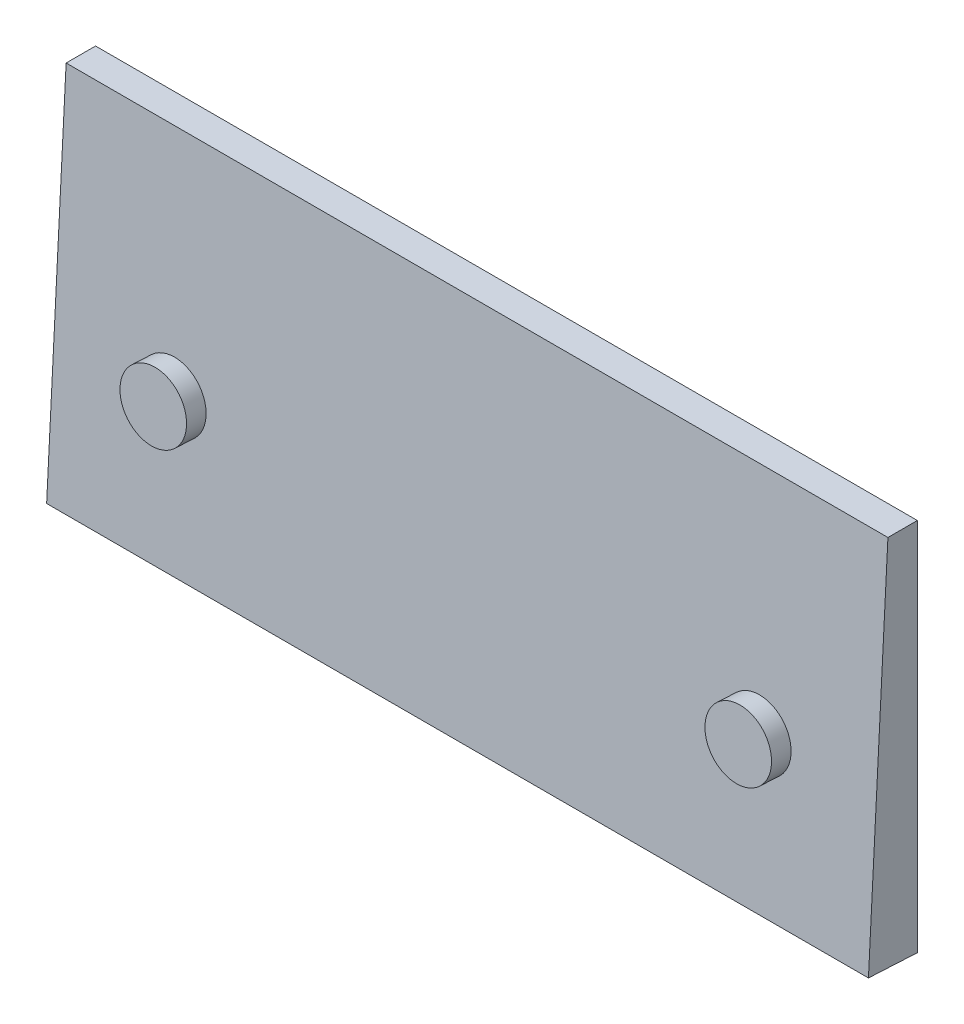
from build123d import *

# Parameters (mm, degrees)
SKETCH1_W           = 84
SKETCH1_H           = 38
BOSS_EXTRUDE1_DEPTH = 5
SKETCH2_W           = 84
SKETCH2_H           = 42
CUT_REVOLVE1_ANGLE  = 3
SKETCH4_R           = 3.4
BOSS_EXTRUDE2_DEPTH = 2
SKETCH5_W           = 84
SKETCH5_H           = 5
REVOLVE1_ANGLE      = 3


with BuildPart() as part:
    # Sketch1 → Boss-Extrude1 (new body)
    with BuildSketch(Plane.XY):
        Rectangle(SKETCH1_W, SKETCH1_H)
    extrude(amount=BOSS_EXTRUDE1_DEPTH)

    # Sketch2 → Cut-Revolve1 (revolve, cut)
    with BuildSketch(Plane.XY.offset(5)):
        with Locations((0, 2)):
            Rectangle(SKETCH2_W, SKETCH2_H)
    revolve(axis=Axis((-42, -19, 5), (-1, 0, 0)), revolution_arc=CUT_REVOLVE1_ANGLE, mode=Mode.SUBTRACT)

    # Sketch4 → Boss-Extrude2 (add)
    with BuildSketch(Plane(origin=(0, 0.209279164, 3.993284337), x_dir=(1, 0, 0), z_dir=(0, 0.05233595624294398, 0.998629534754574))):
        with Locations((29.895651858, -4.083491794)):
            Circle(SKETCH4_R)
        with Locations((-29.895651858, -4.083491794)):
            Circle(SKETCH4_R)
    extrude(amount=BOSS_EXTRUDE2_DEPTH)

    # Sketch5 → Revolve1 (revolve)
    with BuildSketch(Plane.XZ.offset(19)):
        with Locations((0, 2.5)):
            Rectangle(SKETCH5_W, SKETCH5_H)
    revolve(axis=Axis((-42, -19, 5), (-1, 0, 0)), revolution_arc=REVOLVE1_ANGLE)


solid = part.part
